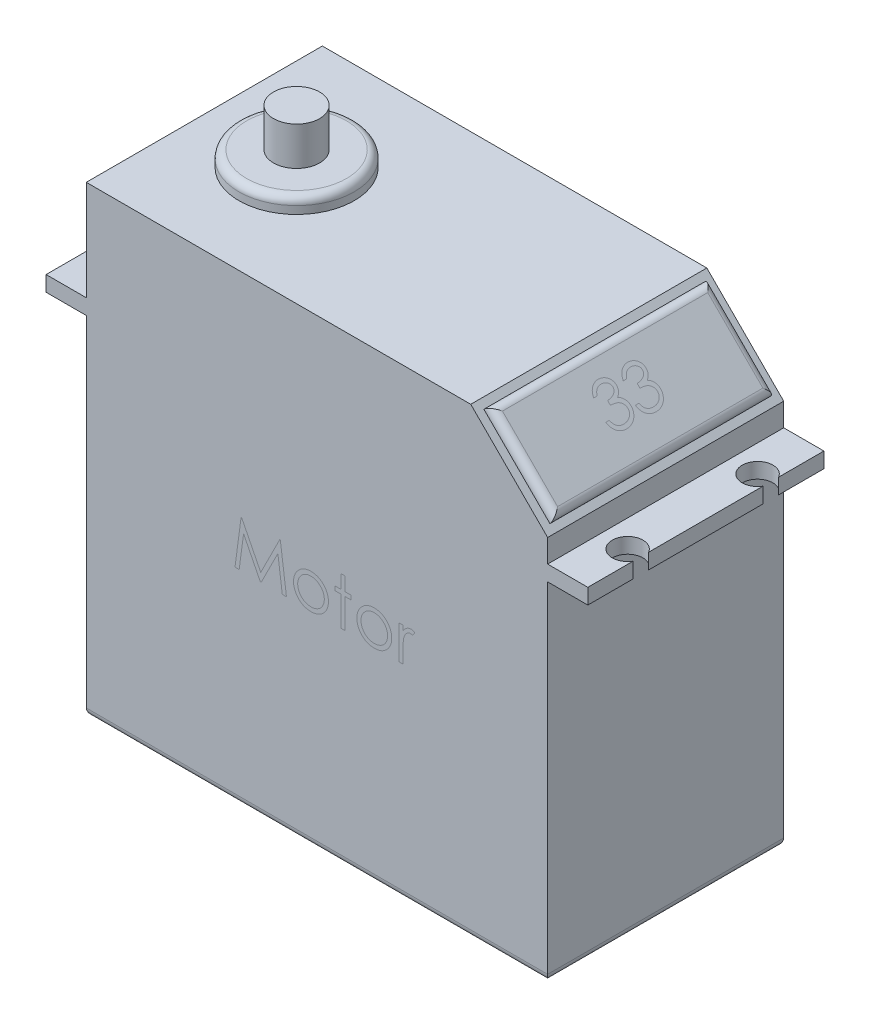
from build123d import *

# Parameters (mm, degrees)
SKETCH1_W           = 60
SKETCH1_H           = 60.2
BOSS_EXTRUDE1_DEPTH = 30.7
BOSS_EXTRUDE2_START = -15
BOSS_EXTRUDE2_DEPTH = 2
SKETCH3_R           = 3
BOSS_EXTRUDE3_DEPTH = 7
CHAMFER1_SIZE       = 10
SKETCH5_R           = 7.5
SKETCH5_R_2         = 3
BOSS_EXTRUDE4_DEPTH = 2
FILLET1_R           = 1
FILLET2_R           = 1
SKETCH6_W           = 28.7
SKETCH6_H           = 12.142135624
BOSS_EXTRUDE5_DEPTH = 1
FILLET3_R           = 1


with BuildPart() as part:
    # Sketch1 → Boss-Extrude1 (new body)
    with BuildSketch(Plane.XY):
        Rectangle(SKETCH1_W, SKETCH1_H)
    extrude(amount=BOSS_EXTRUDE1_DEPTH)

    # Sketch2 → Boss-Extrude2 (add)
    with BuildSketch(Plane(origin=(0, 30.1, 0), x_dir=(1, 0, 0), z_dir=(0, 1, 0)).offset(BOSS_EXTRUDE2_START)):
        with BuildLine():
            Line((-35.224448097, 0), (35.224448097, 0))
            Line((35.224448097, 0), (35.224448097, -5.886945825))
            ThreePointArc((35.224448097, -5.886945825), (31.5, -6.9), (35.224448097, -7.913054175))
            Line((35.224448097, -7.913054175), (35.224448097, -22.786945825))
            ThreePointArc((35.224448097, -22.786945825), (31.5, -23.8), (35.224448097, -24.813054175))
            Line((35.224448097, -24.813054175), (35.224448097, -30.7))
            Line((35.224448097, -30.7), (-35.224448097, -30.7))
            Line((-35.224448097, -30.7), (-35.224448097, -24.813054175))
            ThreePointArc((-35.224448097, -24.813054175), (-31.5, -23.8), (-35.224448097, -22.786945825))
            Line((-35.224448097, -22.786945825), (-35.224448097, -7.913054175))
            ThreePointArc((-35.224448097, -7.913054175), (-31.5, -6.9), (-35.224448097, -5.886945825))
            Line((-35.224448097, -5.886945825), (-35.224448097, 0))
        make_face()
    extrude(amount=BOSS_EXTRUDE2_DEPTH)

    # Sketch3 → Boss-Extrude3 (add)
    with BuildSketch(Plane(origin=(0, 30.1, 0), x_dir=(1, 0, 0), z_dir=(0, 1, 0))):
        with Locations(Location((-18, -15.35, 0), (0, 0, 90))):
            Circle(SKETCH3_R)
    extrude(amount=BOSS_EXTRUDE3_DEPTH)

    # Chamfer1
    chamfer1_edges = [part.edges().sort_by_distance(p)[0] for p in [
        (30, 30.1, 15.35),
    ]]
    chamfer(chamfer1_edges, length=CHAMFER1_SIZE)

    # Sketch5 → Boss-Extrude4 (add)
    with BuildSketch(Plane(origin=(0, 30.1, 0), x_dir=(1, 0, 0), z_dir=(0, 1, 0))):
        with Locations(Location((-18, -15.35, 0), (0, 0, 90))):
            Circle(SKETCH5_R)
        with Locations(Location((-18, -15.35, 0), (0, 0, 270))):
            Circle(SKETCH5_R_2, mode=Mode.SUBTRACT)
    extrude(amount=BOSS_EXTRUDE4_DEPTH)

    # Fillet1
    fillet1_edges = [part.edges().sort_by_distance(p)[0] for p in [
        (-18, 32.1, 22.85),
    ]]
    fillet(fillet1_edges, radius=FILLET1_R)

    # Fillet2
    fillet2_edges = [part.edges().sort_by_distance(p)[0] for p in [
        (0, -30.1, 30.7),
        (0, -30.1, 0),
        (30, -30.1, 15.35),
        (-30, -30.1, 15.35),
    ]]
    fillet(fillet2_edges, radius=FILLET2_R)

    # Sketch6 → Boss-Extrude5 (add)
    with BuildSketch(Plane(origin=(25.05, 25.05, 0), x_dir=(0, 0, -1), z_dir=(0.707106781186549, 0.707106781186546, 0))):
        with Locations((-15.35, 0.070710678)):
            Rectangle(SKETCH6_W, SKETCH6_H)
    extrude(amount=BOSS_EXTRUDE5_DEPTH)

    # Fillet3
    fillet3_edges = [part.edges().sort_by_distance(p)[0] for p in [
        (25.707106781, 25.807106781, 1),
        (30, 21.514213562, 15.35),
        (25.707106781, 25.807106781, 29.7),
        (21.414213562, 30.1, 15.35),
    ]]
    fillet(fillet3_edges, radius=FILLET3_R - 0.0001)  # a hair under: the kernel refuses the full size


solid = part.part
